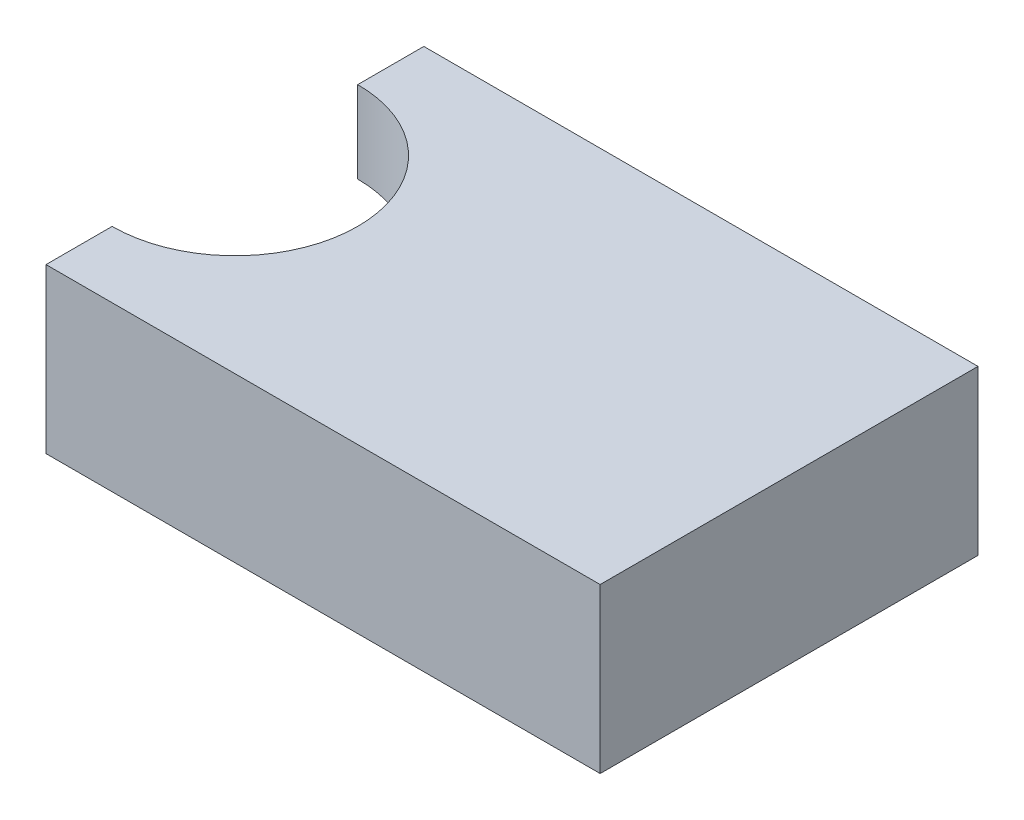
from build123d import *

# Parameters (mm, degrees)
SKETCH2_W           = 110
SKETCH2_H           = 15
BOSS_EXTRUDE1_DEPTH = 3.25
CAVITY1_START       = -2.5
CAVITY1_DEPTH       = 2.5
CAVITY1_START_2     = -1.5
CAVITY1_2_DEPTH     = 4.75
CAVITY1_3_DEPTH     = 1.5
CUT_EXTRUDE1_START  = -5.75
CUT_EXTRUDE1_DEPTH  = 5.75
CUT_EXTRUDE2_START  = -1
CUT_EXTRUDE2_DEPTH  = 1
CUT_EXTRUDE3_START  = -0.2
CUT_EXTRUDE3_DEPTH  = 2.7
CUT_EXTRUDE4_REACH  = 57.888
SKETCH9_W           = 88
SKETCH9_H           = 15
CUT_EXTRUDE5_DEPTH  = 56.888281419


# Read off the part's stored shape, not the designer's step: Cavity1
with BuildPart() as part:
    # Sketch2 → Boss-Extrude1 (new, symmetric)
    with BuildSketch(Plane(origin=(0, 0, 0), x_dir=(1, 0, 0), z_dir=(0, 1, 0))):
        Rectangle(SKETCH2_W, SKETCH2_H)
    extrude(amount=BOSS_EXTRUDE1_DEPTH, both=True)

    # Cavity1 outline → Cavity1 (cut)
    with BuildSketch(Plane(origin=(0, 0, 0), x_dir=(1, 0, 0), z_dir=(0, 1, 0)).offset(CAVITY1_START)):
        with BuildLine():
            ThreePointArc((-55, 2.875), (-52.125, 0), (-55, -2.875))
            Line((-55, -2.875), (-55, -3.425))
            ThreePointArc((-55, -3.425), (-51.575, 0), (-55, 3.425))
            Line((-55, 3.425), (-55, 2.875))
        make_face()
        with BuildLine():
            Line((-55, 6.05), (-55, 4.5))
            ThreePointArc((-55, 4.5), (-50.5, 0), (-55, -4.5))
            Line((-55, -4.5), (-55, -6.05))
            ThreePointArc((-55, -6.05), (-52.834647835, -5.649225611), (-50.956177551, -4.5))
            Line((-50.956177551, -4.5), (-38.326846611, -2.75))
            ThreePointArc((-38.326846611, -2.75), (-35.931628674, 0), (-38.326846611, 2.75))
            Line((-38.326846611, 2.75), (-50.956177551, 4.5))
            ThreePointArc((-50.956177551, 4.5), (-52.834647835, 5.649225611), (-55, 6.05))
        make_face()
    extrude(amount=CAVITY1_DEPTH, mode=Mode.SUBTRACT)

    # Cavity1 2 outline → Cavity1 2 (cut)
    with BuildSketch(Plane(origin=(0, 0, 0), x_dir=(1, 0, 0), z_dir=(0, 1, 0)).offset(CAVITY1_START_2)):
        with BuildLine():
            ThreePointArc((-55, 3), (-52, 0), (-55, -3))
            Line((-55, -3), (-55, -4.375))
            ThreePointArc((-55, -4.375), (-50.625, 0), (-55, 4.375))
            Line((-55, 4.375), (-55, 3))
        make_face()
    extrude(amount=CAVITY1_2_DEPTH, mode=Mode.SUBTRACT)

    # Cavity1 3 outline → Cavity1 3 (cut)
    with BuildSketch(Plane(origin=(0, 0, 0), x_dir=(1, 0, 0), z_dir=(0, 1, 0)).offset(CAVITY1_START_2)):
        with BuildLine():
            Line((-55, 2.875), (-55, 1.5))
            ThreePointArc((-55, 1.5), (-53.5, 0), (-55, -1.5))
            Line((-55, -1.5), (-55, -2.875))
            ThreePointArc((-55, -2.875), (-52.125, 0), (-55, 2.875))
        make_face()
        with BuildLine():
            Line((-55, 4.5), (-55, 4.375))
            ThreePointArc((-55, 4.375), (-50.625, 0), (-55, -4.375))
            Line((-55, -4.375), (-55, -4.5))
            ThreePointArc((-55, -4.5), (-50.5, 0), (-55, 4.5))
        make_face()
    extrude(amount=CAVITY1_3_DEPTH, mode=Mode.SUBTRACT)

    # Sketch4 → Cut-Extrude1 (cut)
    with BuildSketch(Plane(origin=(0, 3.25, 0), x_dir=(1, 0, 0), z_dir=(0, 1, 0)).offset(CUT_EXTRUDE1_START)):
        with BuildLine():
            Line((-55, 3), (-55, -3))
            ThreePointArc((-55, -3), (-52, 0), (-55, 3))
        make_face()
    extrude(amount=CUT_EXTRUDE1_DEPTH, mode=Mode.SUBTRACT)

    # Sketch6 → Cut-Extrude2 (cut)
    with BuildSketch(Plane(origin=(0, -1.5, 0), x_dir=(1, 0, 0), z_dir=(0, 1, 0)).offset(CUT_EXTRUDE2_START)):
        with BuildLine():
            Line((-55, 4.5), (-55, 3.425))
            ThreePointArc((-55, 3.425), (-51.575, 0), (-55, -3.425))
            Line((-55, -3.425), (-55, -4.5))
            ThreePointArc((-55, -4.5), (-50.5, 0), (-55, 4.5))
        make_face()
    extrude(amount=CUT_EXTRUDE2_DEPTH, mode=Mode.SUBTRACT)

    # Sketch7 → Cut-Extrude3 (cut)
    with BuildSketch(Plane(origin=(0, -2.5, 0), x_dir=(1, 0, 0), z_dir=(0, 1, 0)).offset(CUT_EXTRUDE3_START)):
        with BuildLine():
            Line((-38.25821916, 3.24526788), (-50.739154033, 4.974705182))
            ThreePointArc((-50.739154033, 4.974705182), (-52.964952838, 6.225839947), (-55.5, 6.530888148))
            Line((-55.5, 6.530888148), (-55.5, -6.530888148))
            ThreePointArc((-55.5, -6.530888148), (-52.964952838, -6.225839947), (-50.739154033, -4.974705182))
            Line((-50.739154033, -4.974705182), (-38.25821916, -3.24526788))
            ThreePointArc((-38.25821916, -3.24526788), (-35.431628674, 0), (-38.25821916, 3.24526788))
        make_face()
    extrude(amount=CUT_EXTRUDE3_DEPTH, mode=Mode.SUBTRACT)

    # Sketch8 → Cut-Extrude4 (cut, up to next)
    with BuildSketch(Plane(origin=(0, 3.25, 0), x_dir=(1, 0, 0), z_dir=(0, 1, 0)), mode=Mode.PRIVATE) as cut_extrude4_sk1:
        with BuildLine():
            ThreePointArc((-55, 4.375), (-50.625, 0), (-55, -4.375))
            Line((-55, -4.375), (-55, -4.875))
            ThreePointArc((-55, -4.875), (-50.125, 0), (-55, 4.875))
            Line((-55, 4.875), (-55, 4.375))
        make_face()
    cut_extrude4_tool1 = extrude(cut_extrude4_sk1.sketch, amount=-CUT_EXTRUDE4_REACH, mode=Mode.PRIVATE) & part.part
    add(cut_extrude4_tool1.solids().sort_by_distance((-50.515992, 3.25, 0))[0], mode=Mode.SUBTRACT)

    # Sketch9 → Cut-Extrude5 (cut, through all)
    with BuildSketch(Plane(origin=(0, 3.25, 0), x_dir=(1, 0, 0), z_dir=(0, 1, 0))):
        with Locations((11, 0)):
            Rectangle(SKETCH9_W, SKETCH9_H)
    extrude(amount=-CUT_EXTRUDE5_DEPTH, mode=Mode.SUBTRACT)


solid = part.part
